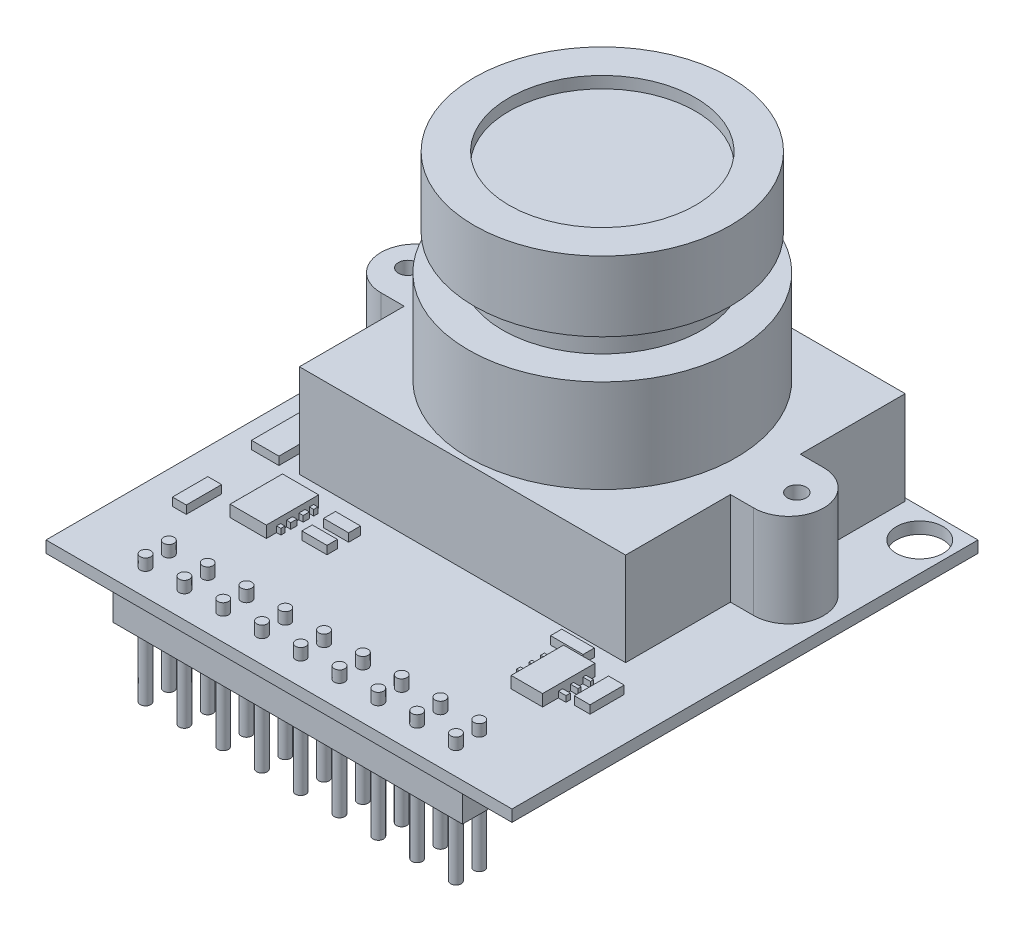
from build123d import *

# Parameters (mm, degrees)
SKETCH_1_W          = 40
SKETCH_1_H          = 40
EXTRUDE_1_DEPTH     = 1
CUT_EXTRUDE_1_DEPTH = 1
EXTRUDE_2_DEPTH     = 8
SKETCH_4_R          = 11.5
EXTRUDE_3_DEPTH     = 8
SKETCH_5_R          = 8.559191368
EXTRUDE_4_DEPTH     = 3
SKETCH_6_R          = 11
EXTRUDE_5_DEPTH     = 6
SKETCH_7_R          = 9.529693481
EXTRUDE_6_DEPTH     = 0.5
CHAMFER_1_SIZE      = 0.5
SKETCH_8_R          = 9.939435953
CUT_EXTRUDE_2_DEPTH = 4.5
SKETCH_9_R          = 9.939435953
SKETCH_9_R_2        = 8
EXTRUDE_7_DEPTH     = 1
SKETCH_10_R         = 4
EXTRUDE_8_DEPTH     = 1
FILLET_2_R          = 0.8
SKETCH_11_R         = 6.007299205
EXTRUDE_9_DEPTH     = 0.5
SKETCH_12_R         = 9.939435953
EXTRUDE_10_DEPTH    = 0.7
SKETCH_13_W         = 2.352989967
SKETCH_13_H         = 5.686392422
SKETCH_13_W_2       = 2.15265452
SKETCH_13_H_2       = 1.022510897
SKETCH_13_H_3       = 0.890753594
SKETCH_13_W_3       = 1.183959986
SKETCH_13_H_4       = 3.036471653
SKETCH_13_W_4       = 2.798450875
SKETCH_13_H_5       = 0.968694534
SKETCH_13_W_5       = 1.345409074
SKETCH_13_H_6       = 2.932991783
EXTRUDE_11_DEPTH    = 0.7
SKETCH_14_W         = 3.107921171
SKETCH_14_H         = 4.492638524
SKETCH_14_W_2       = 2.700983144
SKETCH_14_H_2       = 4.501638572
EXTRUDE_12_DEPTH    = 1
SKETCH_15_W         = 0.507497981
SKETCH_15_H         = 0.354642746
SKETCH_15_H_2       = 0.375504084
SKETCH_15_H_3       = 0.378039024
SKETCH_15_H_4       = 0.396365421
SKETCH_15_W_2       = 0.369096405
SKETCH_15_H_5       = 0.365073415
SKETCH_15_H_6       = 0.534304477
SKETCH_15_H_7       = 0.521967154
SKETCH_15_H_8       = 0.344212076
SKETCH_15_W_3       = 0.65564496
SKETCH_15_H_9       = 0.267152238
SKETCH_15_H_10      = 0.260983577
SKETCH_15_H_11      = 0.370288749
SKETCH_15_W_4       = 0.732663268
SKETCH_15_H_12      = 0.321328161
SKETCH_15_H_13      = 0.27512171
SKETCH_15_H_14      = 0.338459344
EXTRUDE_13_DEPTH    = 0.5
EXTRUDE_14_DEPTH    = 0.1
SKETCH_17_R         = 1.994463981
EXTRUDE_15_DEPTH    = 1
CUT_EXTRUDE_START   = -0.2
CUT_EXTRUDE_3_DEPTH = 0.2
SKETCH_20_W         = 30
SKETCH_20_H         = 5
EXTRUDE_16_DEPTH    = 3
SKETCH_21_R         = 0.45
EXTRUDE_17_DEPTH    = 6
EXTRUDE_START       = -5
SKETCH_22_R         = 0.45
EXTRUDE_18_DEPTH    = 5
SKETCH_23_R         = 0.803105516
CUT_EXTRUDE_4_DEPTH = 8
SCALE_1_SCALE       = 0.6


with BuildPart() as part:
    # 草图1 → 凸台-拉伸1 (new body)
    with BuildSketch(Plane(origin=(0, 0, 0), x_dir=(1, 0, 0), z_dir=(0, 1, 0))):
        Rectangle(SKETCH_1_W, SKETCH_1_H)
    extrude(amount=EXTRUDE_1_DEPTH)

    # 草图2 → 切除-拉伸1 (cut)
    with BuildSketch(Plane(origin=(0, 1, 0), x_dir=(1, 0, 0), z_dir=(0, 1, 0))):
        with BuildLine():
            ThreePointArc((-15.5, 17.5), (-18.914213562, 18.914213562), (-17.5, 15.5))
            Line((-17.5, 15.5), (-17.5, 17.5))
            Line((-17.5, 17.5), (-15.5, 17.5))
        make_face()
        with BuildLine():
            Line((-17.5, 17.5), (-17.5, 15.5))
            ThreePointArc((-17.5, 15.5), (-16.085786438, 16.085786438), (-15.5, 17.5))
            Line((-15.5, 17.5), (-17.5, 17.5))
        make_face()
    cut_extrude_1 = extrude(amount=-CUT_EXTRUDE_1_DEPTH, mode=Mode.SUBTRACT)

    # 镜向1: 切除-拉伸1 across plane
    add(cut_extrude_1.mirror(Plane(origin=(0, 0, 0), x_dir=(0, 0, 1), z_dir=(1, 0, 0))), mode=Mode.SUBTRACT)

    # 草图3 → 凸台-拉伸2 (add)
    with BuildSketch(Plane(origin=(0, 1, 0), x_dir=(1, 0, 0), z_dir=(0, 1, 0))):
        with BuildLine():
            Line((-14, 19.75100221), (14, 19.75100221))
            Line((14, 19.75100221), (14, 10.75100221))
            Line((14, 10.75100221), (16, 10.75100221))
            ThreePointArc((16, 10.75100221), (19, 7.75100221), (16, 4.75100221))
            Line((16, 4.75100221), (14, 4.75100221))
            Line((14, 4.75100221), (14, -4.24899779))
            Line((14, -4.24899779), (-14, -4.24899779))
            Line((-14, -4.24899779), (-14, 4.75100221))
            Line((-14, 4.75100221), (-16, 4.75100221))
            ThreePointArc((-16, 4.75100221), (-19, 7.75100221), (-16, 10.75100221))
            Line((-16, 10.75100221), (-14, 10.75100221))
            Line((-14, 10.75100221), (-14, 19.75100221))
        make_face()
    extrude(amount=EXTRUDE_2_DEPTH)

    # 草图4 → 凸台-拉伸3 (add)
    with BuildSketch(Plane(origin=(0, 9, 0), x_dir=(1, 0, 0), z_dir=(0, 1, 0))):
        with Locations(Location((0, 7.75100221, 0), (0, 0, 270))):
            Circle(SKETCH_4_R)
    extrude(amount=EXTRUDE_3_DEPTH)

    # 草图5 → 凸台-拉伸4 (add)
    with BuildSketch(Plane(origin=(0, 17, 0), x_dir=(1, 0, 0), z_dir=(0, 1, 0))):
        with Locations(Location((0, 7.75100221, 0), (0, 0, 270))):
            Circle(SKETCH_5_R)
    extrude(amount=EXTRUDE_4_DEPTH)

    # 草图6 → 凸台-拉伸5 (add)
    with BuildSketch(Plane(origin=(0, 20, 0), x_dir=(1, 0, 0), z_dir=(0, 1, 0))):
        with Locations(Location((0, 7.75100221, 0), (0, 0, 270))):
            Circle(SKETCH_6_R)
    extrude(amount=EXTRUDE_5_DEPTH)

    # 草图7 → 凸台-拉伸6 (add)
    with BuildSketch(Plane.XZ.offset(-20)):
        with Locations(Location((0, -7.75100221, 0), (0, 0, 90))):
            Circle(SKETCH_7_R)
    extrude(amount=EXTRUDE_6_DEPTH)

    # 倒角1
    chamfer_1_edges = [part.edges().sort_by_distance(p)[0] for p in [
        (0, 19.5, -17.280695691),
    ]]
    chamfer(chamfer_1_edges, length=CHAMFER_1_SIZE - 0.0001)  # a hair under: the kernel refuses the full size

    # 草图8 → 切除-拉伸2 (cut)
    with BuildSketch(Plane(origin=(0, 26, 0), x_dir=(1, 0, 0), z_dir=(0, 1, 0))):
        with Locations(Location((0, 7.75100221, 0), (0, 0, 270))):
            Circle(SKETCH_8_R)
    extrude(amount=-CUT_EXTRUDE_2_DEPTH, mode=Mode.SUBTRACT)

    # 草图9 → 凸台-拉伸7 (add)
    with BuildSketch(Plane(origin=(0, 26, 0), x_dir=(1, 0, 0), z_dir=(0, 1, 0))):
        with Locations(Location((0, 7.75100221, 0), (0, 0, 270))):
            Circle(SKETCH_9_R)
        with Locations(Location((0, 7.75100221, 0), (0, 0, 270))):
            Circle(SKETCH_9_R_2, mode=Mode.SUBTRACT)
    extrude(amount=-EXTRUDE_7_DEPTH)

    # 草图10 → 凸台-拉伸8 (add)
    with BuildSketch(Plane(origin=(0, 21.5, 0), x_dir=(1, 0, 0), z_dir=(0, 1, 0))):
        with Locations(Location((0, 7.75100221, 0), (0, 0, 270))):
            Circle(SKETCH_10_R)
    extrude(amount=EXTRUDE_8_DEPTH)

    # 圆角2
    fillet_2_edges = [part.edges().sort_by_distance(p)[0] for p in [
        (0, 22.5, -11.75100221),
    ]]
    fillet(fillet_2_edges, radius=FILLET_2_R)

    # 草图11 → 凸台-拉伸9 (add)
    with BuildSketch(Plane(origin=(0, 21.5, 0), x_dir=(1, 0, 0), z_dir=(0, 1, 0))):
        with Locations(Location((0, 7.75100221, 0), (0, 0, 270))):
            Circle(SKETCH_11_R)
    extrude(amount=EXTRUDE_9_DEPTH)

    # 草图12 → 凸台-拉伸10 (add)
    with BuildSketch(Plane.XZ.offset(-25)):
        with Locations(Location((0, -7.75100221, 0), (0, 0, 90))):
            Circle(SKETCH_12_R)
    extrude(amount=EXTRUDE_10_DEPTH)

    # 草图13 → 凸台-拉伸11 (add)
    with BuildSketch(Plane(origin=(0, 1, 0), x_dir=(1, 0, 0), z_dir=(0, 1, 0))):
        with Locations((-16.711611077, -1.629306924)):
            Rectangle(SKETCH_13_W, SKETCH_13_H)
        with Locations((-7.914164111, -6.672955498)):
            Rectangle(SKETCH_13_W_2, SKETCH_13_H_2)
        with Locations((-7.914164111, -8.599651528)):
            Rectangle(SKETCH_13_W_2, SKETCH_13_H_3)
        with Locations((-16.470965826, -10.563264152)):
            Rectangle(SKETCH_13_W_3, SKETCH_13_H_4)
        with Locations((10.867746572, -5.677352782)):
            Rectangle(SKETCH_13_W_4, SKETCH_13_H_5)
        with Locations((15.630494696, -8.139451388)):
            Rectangle(SKETCH_13_W_5, SKETCH_13_H_6)
    extrude(amount=EXTRUDE_11_DEPTH)

    # 草图14 → 凸台-拉伸12 (add)
    with BuildSketch(Plane(origin=(0, 1, 0), x_dir=(1, 0, 0), z_dir=(0, 1, 0))):
        with Locations((-12.202988876, -8.190097528)):
            Rectangle(SKETCH_14_W, SKETCH_14_H)
        with Locations((12.382417477, -8.856694603)):
            Rectangle(SKETCH_14_W_2, SKETCH_14_H_2)
    extrude(amount=EXTRUDE_12_DEPTH)

    # 草图15 → 凸台-拉伸13 (add)
    with BuildSketch(Plane(origin=(0, 1, 0), x_dir=(1, 0, 0), z_dir=(0, 1, 0))):
        with Locations((-14.010698452, -6.741935711)):
            Rectangle(SKETCH_15_W, SKETCH_15_H)
        with Locations((-14.010698452, -7.649403914)):
            Rectangle(SKETCH_15_W, SKETCH_15_H_2)
        with Locations((-14.010698452, -8.712064682)):
            Rectangle(SKETCH_15_W, SKETCH_15_H_3)
        with Locations((-14.010698452, -9.55821634)):
            Rectangle(SKETCH_15_W, SKETCH_15_H_4)
        with Locations((-10.464480088, -6.559399004)):
            Rectangle(SKETCH_15_W_2, SKETCH_15_H_5)
        with Locations((-10.464480088, -7.382251676)):
            Rectangle(SKETCH_15_W_2, SKETCH_15_H_6)
        with Locations((-10.464480088, -8.451081105)):
            Rectangle(SKETCH_15_W_2, SKETCH_15_H_7)
        with Locations((-10.464480088, -9.386110302)):
            Rectangle(SKETCH_15_W_2, SKETCH_15_H_8)
        with Locations((14.060731529, -7.515827795)):
            Rectangle(SKETCH_15_W_3, SKETCH_15_H_9)
        with Locations((14.060731529, -8.581572894)):
            Rectangle(SKETCH_15_W_3, SKETCH_15_H_10)
        with Locations((14.060731529, -9.571254677)):
            Rectangle(SKETCH_15_W_3, SKETCH_15_H_11)
        with Locations((10.665594271, -7.676491876)):
            Rectangle(SKETCH_15_W_4, SKETCH_15_H_12)
        with Locations((10.665594271, -8.719133748)):
            Rectangle(SKETCH_15_W_4, SKETCH_15_H_13)
        with Locations((10.665594271, -9.740484349)):
            Rectangle(SKETCH_15_W_4, SKETCH_15_H_14)
    extrude(amount=EXTRUDE_13_DEPTH)

    # 草图16 → 凸台-拉伸14 (add)
    with BuildSketch(Plane.XZ):
        Polygon((-14, -4.75100221), (-14, -10.75100221), (-14, -19.75100221), (14, -19.75100221), (14, -10.75100221), (14, -4.75100221), (14, 4.24899779), (-14, 4.24899779), align=None)
    extrude(amount=EXTRUDE_14_DEPTH)

    # 草图17 → 凸台-拉伸15 (add)
    with BuildSketch(Plane.XZ):
        with Locations(Location((-16.636759376, -7.75100221, 0), (0, 0, 90))):
            Circle(SKETCH_17_R)
    extrude_15 = extrude(amount=EXTRUDE_15_DEPTH)

    # 镜向2: 凸台-拉伸15 across plane
    add(extrude_15.mirror(Plane(origin=(0, 0, 0), x_dir=(0, 0, 1), z_dir=(1, 0, 0))))

    # 草图18 → 切除-拉伸3 (cut)
    with BuildSketch(Plane.XZ.offset(1).offset(CUT_EXTRUDE_START)):
        with BuildLine():
            ThreePointArc((-16.214719096, -5.801702701), (-16.636759376, -5.756538229), (-17.058799655, -5.801702701))
            Line((-17.058799655, -5.801702701), (-17.058799655, -7.326073559))
            Line((-17.058799655, -7.326073559), (-18.585431286, -7.326073559))
            ThreePointArc((-18.585431286, -7.326073559), (-18.631223357, -7.75100221), (-18.585431286, -8.175930861))
            Line((-18.585431286, -8.175930861), (-17.058799655, -8.175930861))
            Line((-17.058799655, -8.175930861), (-17.058799655, -9.700301718))
            ThreePointArc((-17.058799655, -9.700301718), (-16.636759376, -9.745466191), (-16.214719096, -9.700301718))
            Line((-16.214719096, -9.700301718), (-16.214719096, -8.175930861))
            Line((-16.214719096, -8.175930861), (-14.688087465, -8.175930861))
            ThreePointArc((-14.688087465, -8.175930861), (-14.653776457, -7.96469666), (-14.642295394, -7.75100221))
            ThreePointArc((-14.642295394, -7.75100221), (-14.653776457, -7.53730776), (-14.688087465, -7.326073559))
            Line((-14.688087465, -7.326073559), (-16.214719096, -7.326073559))
            Line((-16.214719096, -7.326073559), (-16.214719096, -5.801702701))
        make_face()
    cut_extrude_3 = extrude(amount=CUT_EXTRUDE_3_DEPTH, mode=Mode.SUBTRACT)

    # 镜向3: 切除-拉伸3 across plane
    add(cut_extrude_3.mirror(Plane(origin=(0, 0, 0), x_dir=(0, 0, 1), z_dir=(1, 0, 0))), mode=Mode.SUBTRACT)

    # 草图19 → 旋转1 (revolve)
    with BuildSketch(Plane(origin=(0, 0, 0), x_dir=(0, 0, -1), z_dir=(1, 0, 0))):
        with BuildLine():
            Line((7.75100221, 18.762960374), (7.75100221, 23.632721698))
            ThreePointArc((7.75100221, 23.632721698), (5.316121548, 21.197841036), (7.75100221, 18.762960374))
        make_face()
    revolve(axis=Axis((0, 22.5, -7.75100221), (0, -1, 0)))

    # 草图20 → 凸台-拉伸16 (add)
    with BuildSketch(Plane.XZ):
        with Locations((0, 16.74899779)):
            Rectangle(SKETCH_20_W, SKETCH_20_H)
    extrude(amount=EXTRUDE_16_DEPTH)

    # 草图21 → 凸台-拉伸17 (add)
    with BuildSketch(Plane.XZ.offset(3)):
        with Locations(Location((-13.70289303, 17.74899779, 0), (0, 0, 270))):
            Circle(SKETCH_21_R)
        with Locations(Location((-13.70289303, 15.74899779, 0), (0, 0, 270))):
            Circle(SKETCH_21_R)
        with Locations(Location((-10.37289303, 15.74899779, 0), (0, 0, 270))):
            Circle(SKETCH_21_R)
        with Locations(Location((-10.37289303, 17.74899779, 0), (0, 0, 270))):
            Circle(SKETCH_21_R)
        with Locations(Location((-7.04289303, 15.74899779, 0), (0, 0, 270))):
            Circle(SKETCH_21_R)
        with Locations(Location((-7.04289303, 17.74899779, 0), (0, 0, 270))):
            Circle(SKETCH_21_R)
        with Locations(Location((-3.71289303, 15.74899779, 0), (0, 0, 270))):
            Circle(SKETCH_21_R)
        with Locations(Location((-3.71289303, 17.74899779, 0), (0, 0, 270))):
            Circle(SKETCH_21_R)
        with Locations(Location((-0.38289303, 15.74899779, 0), (0, 0, 270))):
            Circle(SKETCH_21_R)
        with Locations(Location((-0.38289303, 17.74899779, 0), (0, 0, 270))):
            Circle(SKETCH_21_R)
        with Locations(Location((2.94710697, 15.74899779, 0), (0, 0, 270))):
            Circle(SKETCH_21_R)
        with Locations(Location((2.94710697, 17.74899779, 0), (0, 0, 270))):
            Circle(SKETCH_21_R)
        with Locations(Location((6.27710697, 15.74899779, 0), (0, 0, 270))):
            Circle(SKETCH_21_R)
        with Locations(Location((6.27710697, 17.74899779, 0), (0, 0, 270))):
            Circle(SKETCH_21_R)
        with Locations(Location((9.60710697, 15.74899779, 0), (0, 0, 270))):
            Circle(SKETCH_21_R)
        with Locations(Location((9.60710697, 17.74899779, 0), (0, 0, 270))):
            Circle(SKETCH_21_R)
        with Locations(Location((12.93710697, 15.74899779, 0), (0, 0, 270))):
            Circle(SKETCH_21_R)
        with Locations(Location((12.93710697, 17.74899779, 0), (0, 0, 270))):
            Circle(SKETCH_21_R)
    extrude(amount=EXTRUDE_17_DEPTH)

    # 草图22 → 凸台-拉伸18 (add)
    with BuildSketch(Plane.XZ.offset(3).offset(EXTRUDE_START)):
        with Locations(Location((12.93710697, 17.74899779, 0), (0, 0, 270))):
            Circle(SKETCH_22_R)
        with Locations(Location((12.93710697, 15.74899779, 0), (0, 0, 270))):
            Circle(SKETCH_22_R)
        with Locations(Location((9.60710697, 15.74899779, 0), (0, 0, 270))):
            Circle(SKETCH_22_R)
        with Locations(Location((9.60710697, 17.74899779, 0), (0, 0, 270))):
            Circle(SKETCH_22_R)
        with Locations(Location((6.27710697, 17.74899779, 0), (0, 0, 270))):
            Circle(SKETCH_22_R)
        with Locations(Location((6.27710697, 15.74899779, 0), (0, 0, 270))):
            Circle(SKETCH_22_R)
        with Locations(Location((-0.38289303, 15.74899779, 0), (0, 0, 270))):
            Circle(SKETCH_22_R)
        with Locations(Location((2.94710697, 15.74899779, 0), (0, 0, 270))):
            Circle(SKETCH_22_R)
        with Locations(Location((2.94710697, 17.74899779, 0), (0, 0, 270))):
            Circle(SKETCH_22_R)
        with Locations(Location((-0.38289303, 17.74899779, 0), (0, 0, 270))):
            Circle(SKETCH_22_R)
        with Locations(Location((-3.71289303, 15.74899779, 0), (0, 0, 270))):
            Circle(SKETCH_22_R)
        with Locations(Location((-3.71289303, 17.74899779, 0), (0, 0, 270))):
            Circle(SKETCH_22_R)
        with Locations(Location((-7.04289303, 15.74899779, 0), (0, 0, 270))):
            Circle(SKETCH_22_R)
        with Locations(Location((-7.04289303, 17.74899779, 0), (0, 0, 270))):
            Circle(SKETCH_22_R)
        with Locations(Location((-10.37289303, 15.74899779, 0), (0, 0, 270))):
            Circle(SKETCH_22_R)
        with Locations(Location((-10.37289303, 17.74899779, 0), (0, 0, 270))):
            Circle(SKETCH_22_R)
        with Locations(Location((-13.70289303, 15.74899779, 0), (0, 0, 270))):
            Circle(SKETCH_22_R)
        with Locations(Location((-13.70289303, 17.74899779, 0), (0, 0, 270))):
            Circle(SKETCH_22_R)
    extrude(amount=EXTRUDE_18_DEPTH)

    # 草图23 → 切除-拉伸4 (cut)
    with BuildSketch(Plane(origin=(0, 9, 0), x_dir=(1, 0, 0), z_dir=(0, 1, 0))):
        with Locations(Location((16.697524891, 7.75100221, 0), (0, 0, 270))):
            Circle(SKETCH_23_R)
    cut_extrude_4 = extrude(amount=-CUT_EXTRUDE_4_DEPTH, mode=Mode.SUBTRACT)

    # 镜向4: 切除-拉伸4 across plane
    add(cut_extrude_4.mirror(Plane(origin=(0, 0, 0), x_dir=(0, 0, 1), z_dir=(1, 0, 0))), mode=Mode.SUBTRACT)


with BuildPart() as part_1:
    # 缩放比例1: scaled about (0, 0, 0)
    add(part.part.scale(SCALE_1_SCALE))


solid = part_1.part
